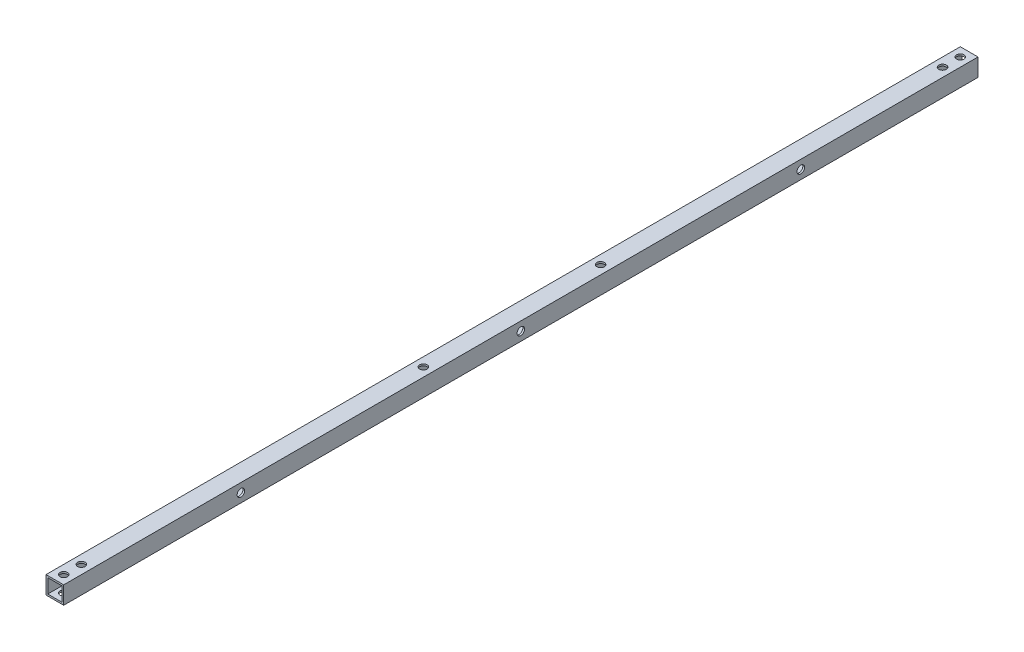
from build123d import *

# Parameters (mm, degrees)
SKETCH1_W           = 10
SKETCH1_H           = 10
SKETCH1_W_2         = 8
SKETCH1_H_2         = 8
BOSS_EXTRUDE1_DEPTH = 516
SKETCH2_R           = 2.125
CUT_EXTRUDE1_DEPTH  = 116
SKETCH3_R           = 2.125
CUT_EXTRUDE2_DEPTH  = 10
SKETCH4_R           = 2.125
CUT_EXTRUDE3_DEPTH  = 10


with BuildPart() as part:
    # Sketch1 → Boss-Extrude1 (new body)
    with BuildSketch(Plane.XY):
        with Locations((5, 5)):
            Rectangle(SKETCH1_W, SKETCH1_H)
        with Locations((5, 5)):
            Rectangle(SKETCH1_W_2, SKETCH1_H_2, mode=Mode.SUBTRACT)
    extrude(amount=BOSS_EXTRUDE1_DEPTH)

    # Sketch2 → Cut-Extrude1 (cut)
    with BuildSketch(Plane(origin=(0, 10, 0), x_dir=(1, 0, 0), z_dir=(0, 1, 0))):
        with Locations((5, -5)):
            Circle(SKETCH2_R)
        with Locations((5, -15)):
            Circle(SKETCH2_R)
        with Locations((5, -501)):
            Circle(SKETCH2_R)
        with Locations((5, -511)):
            Circle(SKETCH2_R)
    extrude(amount=-CUT_EXTRUDE1_DEPTH, mode=Mode.SUBTRACT)

    # Sketch3 → Cut-Extrude2 (cut)
    with BuildSketch(Plane.XZ):
        with Locations((5, 308)):
            Circle(SKETCH3_R)
        with Locations((5, 208)):
            Circle(SKETCH3_R)
    extrude(amount=-CUT_EXTRUDE2_DEPTH, mode=Mode.SUBTRACT)

    # Sketch4 → Cut-Extrude3 (cut)
    with BuildSketch(Plane(origin=(10, 0, 0), x_dir=(0, 0, -1), z_dir=(1, 0, 0))):
        with Locations((-416, 5)):
            Circle(SKETCH4_R)
        with Locations((-100, 5)):
            Circle(SKETCH4_R)
        with Locations((-258, 5)):
            Circle(SKETCH4_R)
    extrude(amount=-CUT_EXTRUDE3_DEPTH, mode=Mode.SUBTRACT)


solid = part.part
